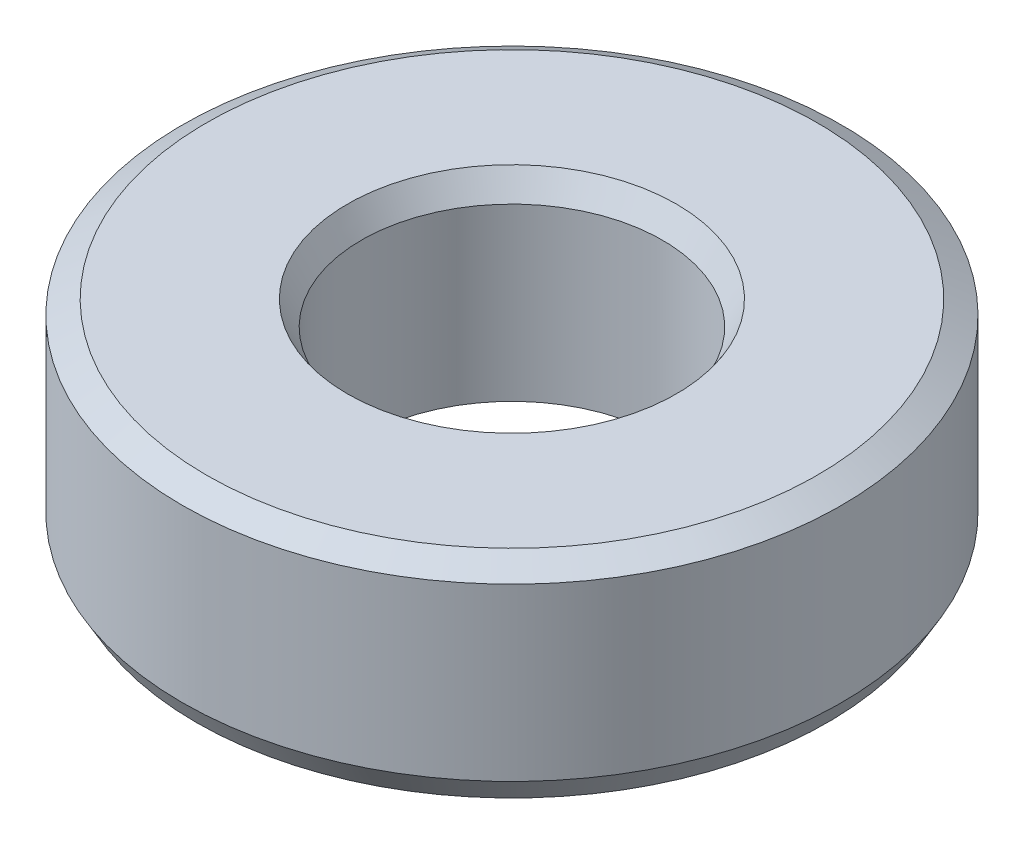
from build123d import *
from OCP.BRepFilletAPI import BRepFilletAPI_MakeChamfer

# Parameters (mm, degrees)
SKETCH1_R           = 37.5
BOSS_EXTRUDE1_DEPTH = 23.788989885
SKETCH2_R           = 17.122983983
CUT_EXTRUDE1_DEPTH  = 59.124143346
CHAMFER1_SIZE       = 1.591917607
CHAMFER1_SIZE2      = 2.757282177


with BuildPart() as part:
    # Sketch1 → Boss-Extrude1 (new body)
    with BuildSketch(Plane(origin=(0, 0, 0), x_dir=(1, 0, 0), z_dir=(0, 1, 0))):
        Circle(SKETCH1_R)
    extrude(amount=BOSS_EXTRUDE1_DEPTH)

    # Sketch2 → Cut-Extrude1 (cut, through all)
    with BuildSketch(Plane(origin=(0, 0, 0), x_dir=(1, 0, 0), z_dir=(0, 1, 0))):
        Circle(SKETCH2_R)
    extrude(amount=CUT_EXTRUDE1_DEPTH, mode=Mode.SUBTRACT)

    # Chamfer1: one chamfer whose edges measure the first distance from different faces: ONE call of the kernel's chamfer builder (chamfer() names one face for all edges)
    chamfer1_edges_1 = [part.edges().sort_by_distance(p)[0] for p in [
        (-17.122983983, 23.788989885, 0),
    ]]
    chamfer1_side_1 = [part.faces().sort_by_distance(p)[0] for p in [
        (-36.439339828, 23.788989885, 0),
    ]]
    chamfer1_edges_2 = [part.edges().sort_by_distance(p)[0] for p in [
        (-17.122983983, 0, 0),
    ]]
    chamfer1_side_2 = [part.faces().sort_by_distance(p)[0] for p in [
        (-17.122983983, 11.894494942, 0),
    ]]
    chamfer1_edges_3 = [part.edges().sort_by_distance(p)[0] for p in [
        (-37.5, 0, 0),
    ]]
    chamfer1_side_3 = [part.faces().sort_by_distance(p)[0] for p in [
        (-36.439339828, 0, 0),
    ]]
    chamfer1_edges_4 = [part.edges().sort_by_distance(p)[0] for p in [
        (-37.5, 23.788989885, 0),
    ]]
    chamfer1_side_4 = [part.faces().sort_by_distance(p)[0] for p in [
        (-37.5, 11.894494942, 0),
    ]]
    chamfer1 = BRepFilletAPI_MakeChamfer(part.part.solid().wrapped)
    for e in chamfer1_edges_1:
        chamfer1.Add(CHAMFER1_SIZE, CHAMFER1_SIZE2, e.wrapped, chamfer1_side_1[0].wrapped)  # the first distance lies on this face
    for e in chamfer1_edges_2:
        chamfer1.Add(CHAMFER1_SIZE, CHAMFER1_SIZE2, e.wrapped, chamfer1_side_2[0].wrapped)  # the first distance lies on this face
    for e in chamfer1_edges_3:
        chamfer1.Add(CHAMFER1_SIZE, CHAMFER1_SIZE2, e.wrapped, chamfer1_side_3[0].wrapped)  # the first distance lies on this face
    for e in chamfer1_edges_4:
        chamfer1.Add(CHAMFER1_SIZE, CHAMFER1_SIZE2, e.wrapped, chamfer1_side_4[0].wrapped)  # the first distance lies on this face
    add(Compound.cast(chamfer1.Shape()), mode=Mode.REPLACE)


solid = part.part
